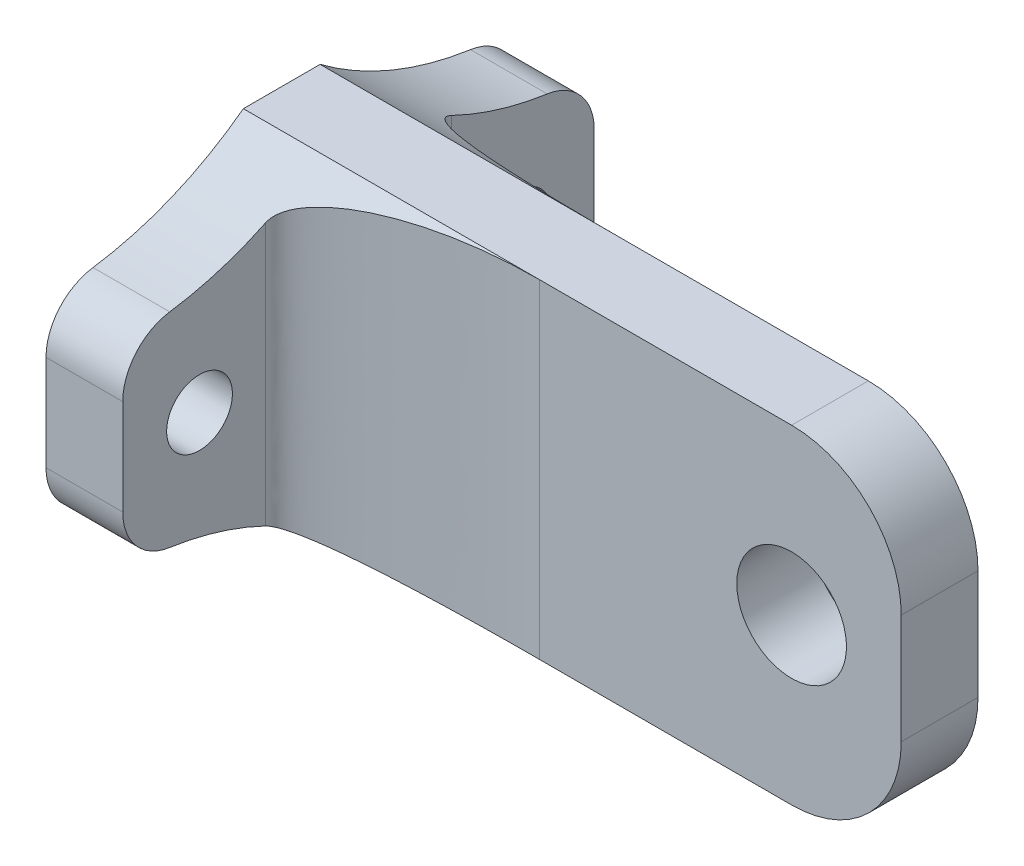
from build123d import *

# Parameters (mm, degrees)
SKETCH_1_W          = 60
SKETCH_1_H          = 30
EXTRUDE_1_DEPTH     = 7
CUT_EXTRUDE_1_REACH = 69.446
SKETCH_2_R          = 5
SKETCH_3_W          = 7
SKETCH_3_H          = 18
EXTRUDE_2_DEPTH     = 18
SKETCH_4_W          = 7
SKETCH_4_H          = 18
EXTRUDE_3_DEPTH     = 18
CUT_EXTRUDE_2_REACH = 73.589
SKETCH_5_R          = 3
FILLET_2_SIZE       = 20
FILLET_2_SIZE_2     = 5
FILLET_3_DEPTH      = 27.0000001
FILLET_START        = -1
FILLET_3_2_DEPTH    = 32
FILLET_4_R          = 5
FILLET_5_R          = 5
FILLET_6_R          = 5
FILLET_7_R          = 5
FILLET_8_R          = 10


with BuildPart() as part:
    # 草图1 → 凸台-拉伸1 (new body)
    with BuildSketch(Plane.XY):
        with Locations((30, 15)):
            Rectangle(SKETCH_1_W, SKETCH_1_H)
    extrude(amount=EXTRUDE_1_DEPTH)

    # 草图2 → 切除-拉伸1 (cut, up to next)
    with BuildSketch(Plane(origin=(0, 0, 0), x_dir=(-1, 0, 0), z_dir=(0, 0, -1)), mode=Mode.PRIVATE) as cut_extrude_1_sk1:
        with Locations((-50, 15)):
            Circle(SKETCH_2_R)
    cut_extrude_1_tool1 = extrude(cut_extrude_1_sk1.sketch, amount=-CUT_EXTRUDE_1_REACH, mode=Mode.PRIVATE) & part.part
    add(cut_extrude_1_tool1.solids().sort_by_distance((50, 15, 0))[0], mode=Mode.SUBTRACT)

    # 草图3 → 凸台-拉伸2 (add)
    with BuildSketch(Plane.XY.offset(7)):
        with Locations((3.5, 15)):
            Rectangle(SKETCH_3_W, SKETCH_3_H)
    extrude(amount=EXTRUDE_2_DEPTH)

    # 草图4 → 凸台-拉伸3 (add)
    with BuildSketch(Plane(origin=(0, 0, 0), x_dir=(-1, 0, 0), z_dir=(0, 0, -1))):
        with Locations((-3.5, 15)):
            Rectangle(SKETCH_4_W, SKETCH_4_H)
    extrude(amount=EXTRUDE_3_DEPTH)

    # 草图5 → 切除-拉伸2 (cut, up to next)
    with BuildSketch(Plane.ZY, mode=Mode.PRIVATE) as cut_extrude_2_sk1:
        with Locations((-11, 15)):
            Circle(SKETCH_5_R)
    cut_extrude_2_tool1 = extrude(cut_extrude_2_sk1.sketch, amount=-CUT_EXTRUDE_2_REACH, mode=Mode.PRIVATE) & part.part
    # 草图5 → 切除-拉伸2 (cut, up to next)
    with BuildSketch(Plane.ZY, mode=Mode.PRIVATE) as cut_extrude_2_sk2:
        with Locations((18, 15)):
            Circle(SKETCH_5_R)
    cut_extrude_2_tool2 = extrude(cut_extrude_2_sk2.sketch, amount=-CUT_EXTRUDE_2_REACH, mode=Mode.PRIVATE) & part.part
    add(cut_extrude_2_tool1.solids().sort_by_distance((0, 15, -11))[0], mode=Mode.SUBTRACT)
    add(cut_extrude_2_tool2.solids().sort_by_distance((0, 15, 18))[0], mode=Mode.SUBTRACT)

    # 圆角2
    # a fillet whose section is not a circle: 20, 5 mm, written as the material it adds along each edge
    with BuildSketch(Plane(origin=(7, 24, 7), x_dir=(1, 0, 0), z_dir=(0, -1, 0))) as fillet_2_piece_1:
        with BuildLine():
            Bezier((FILLET_2_SIZE, 0), (0, 0), (0, FILLET_2_SIZE_2), weights=[1, 0.707106781, 1])
            Line((0, FILLET_2_SIZE_2), (0, 0))
            Line((0, 0), (FILLET_2_SIZE, 0))
        make_face()
    extrude(amount=18)
    with BuildSketch(Plane(origin=(7, 24, 0), x_dir=(1, 0, 0), z_dir=(0, -1, 0))) as fillet_2_piece_2:
        with BuildLine():
            Bezier((FILLET_2_SIZE, 0), (0, 0), (0, -FILLET_2_SIZE_2), weights=[1, 0.707106781, 1])
            Line((0, -FILLET_2_SIZE_2), (0, 0))
            Line((0, 0), (FILLET_2_SIZE, 0))
        make_face()
    extrude(amount=18)

    # 圆角3: read off the stored shape, not the designer's step
    # 圆角3 outline → 圆角3 (add)
    with BuildSketch(Plane.YZ):
        with BuildLine():
            Line((24, 25), (24, 7))
            Line((24, 7), (30, 7))
            ThreePointArc((30, 7), (25.539501058, 15.513167019), (24, 25))
        make_face()
        with BuildLine():
            ThreePointArc((6, 25), (4.460498942, 15.513167019), (0, 7))
            Line((0, 7), (6, 7))
            Line((6, 7), (6, 25))
        make_face()
        with BuildLine():
            Line((24, 0), (24, -18))
            ThreePointArc((24, -18), (25.539501058, -8.513167019), (30, 0))
            Line((30, 0), (24, 0))
        make_face()
        with BuildLine():
            Line((6, -18), (6, 0))
            Line((6, 0), (0, 0))
            ThreePointArc((0, 0), (4.460498942, -8.513167019), (6, -18))
        make_face()
    extrude(amount=FILLET_3_DEPTH)

    # Fillet 3 2 outline → Fillet 3 2 (cut)
    with BuildSketch(Plane(origin=(0, 0, 0), x_dir=(1, 0, 0), z_dir=(0, 1, 0)).offset(FILLET_START)):
        with BuildLine():
            add(Edge.make_bspline(
                [(7, -12), (7, -7), (27, -7)],
                knots=[0, 0, 0, 1, 1, 1], degree=2, weights=[1, 0.707106781, 1]))
            Line((7, -12), (7, -25))
            Line((7, -25), (27.0000001, -25))
            Line((27.0000001, -25), (27, -7))
        make_face()
        with BuildLine():
            Line((27.0000001, 18), (7, 18))
            Line((7, 18), (7, 5))
            add(Edge.make_bspline(
                [(27, 0), (7, 0), (7, 5)],
                knots=[0, 0, 0, 1, 1, 1], degree=2, weights=[1, 0.707106781, 1]))
            Line((27, 0), (27.0000001, 18))
        make_face()
    extrude(amount=FILLET_3_2_DEPTH, mode=Mode.SUBTRACT)

    # 圆角4
    fillet_4_edges = [part.edges().sort_by_distance(p)[0] for p in [
        (3.5, 24, 25),
    ]]
    fillet(fillet_4_edges, radius=FILLET_4_R)

    # 圆角5
    fillet_5_edges = [part.edges().sort_by_distance(p)[0] for p in [
        (3.5, 6, 25),
    ]]
    fillet(fillet_5_edges, radius=FILLET_5_R)

    # 圆角6
    fillet_6_edges = [part.edges().sort_by_distance(p)[0] for p in [
        (3.5, 6, -18),
    ]]
    fillet(fillet_6_edges, radius=FILLET_6_R)

    # 圆角7
    fillet_7_edges = [part.edges().sort_by_distance(p)[0] for p in [
        (3.5, 24, -18),
    ]]
    fillet(fillet_7_edges, radius=FILLET_7_R)

    # 圆角8
    fillet_8_edges = [part.edges().sort_by_distance(p)[0] for p in [
        (60, 0, 3.5),
        (60, 30, 3.5),
    ]]
    fillet(fillet_8_edges, radius=FILLET_8_R)


solid = part.part
